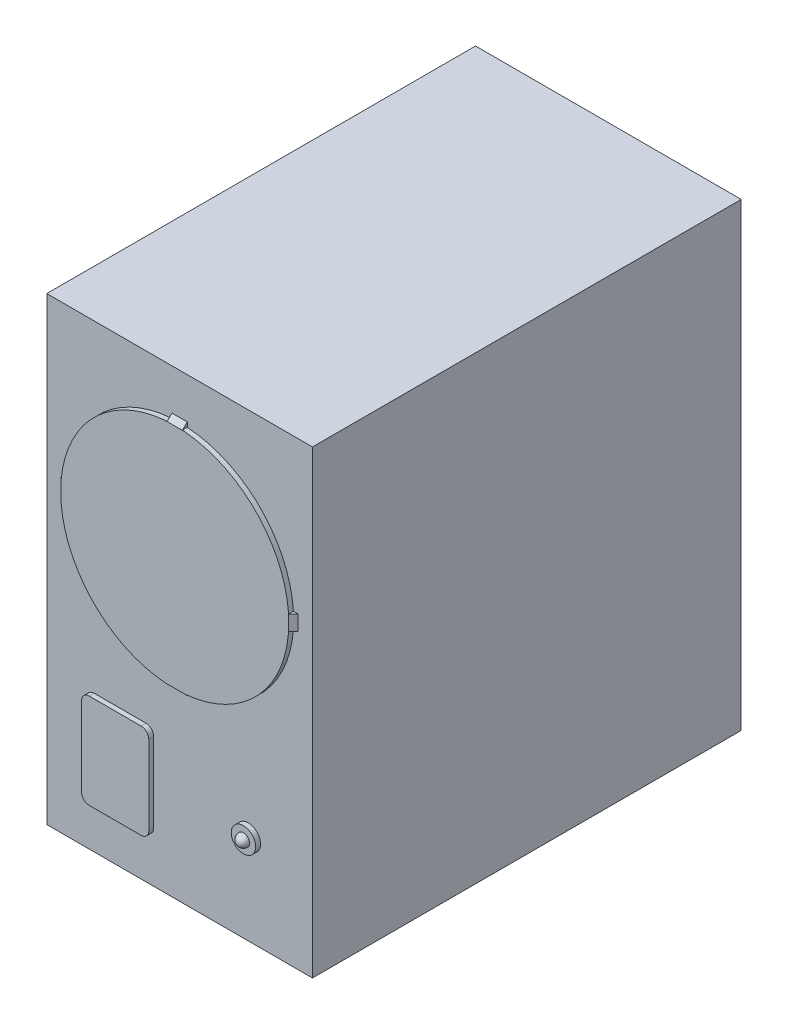
from build123d import *
from build123d.topology import SkipClean

# Parameters (mm, degrees)
ESQUISSE1_W        = 87
ESQUISSE1_H        = 140.4
BOSS_EXTRU_1_DEPTH = 150.6
ESQUISSE2_W        = 2.433761929
ESQUISSE2_H        = 5
ESQUISSE2_W_2      = 5
ESQUISSE2_H_2      = 2.433761929
ESQUISSE2_R        = 4
BOSS_EXTRU_5_DEPTH = 1.6
R_VOLUTION1_ANGLE  = 180
CHANFREIN1_SIZE    = 2.5
BOSS_EXTRU_6_DEPTH = 5


with BuildPart() as part:
    # Esquisse1 → Boss.-Extru.1 (new body)
    with BuildSketch(Plane(origin=(0, 0, 0), x_dir=(1, 0, 0), z_dir=(0, 1, 0))):
        Rectangle(ESQUISSE1_W, ESQUISSE1_H)
    extrude(amount=BOSS_EXTRU_1_DEPTH)

    # Esquisse2 → Boss.-Extru.5 (add)
    with BuildSketch(Plane.XY.offset(70.2)):
        with BuildLine():
            Line((-37.266238071, 100.9), (-37.266238071, 95.9))
            ThreePointArc((-37.266238071, 95.9), (-26.410438277, 71.989561723), (-2.5, 61.133761929))
            Line((-2.5, 61.133761929), (2.5, 61.133761929))
            ThreePointArc((2.5, 61.133761929), (26.410438277, 71.989561723), (37.266238071, 95.9))
            Line((37.266238071, 95.9), (37.266238071, 100.9))
            ThreePointArc((37.266238071, 100.9), (26.410438277, 124.810438277), (2.5, 135.666238071))
            Line((2.5, 135.666238071), (-2.5, 135.666238071))
            ThreePointArc((-2.5, 135.666238071), (-26.410438277, 124.810438277), (-37.266238071, 100.9))
        make_face()
        with Locations((38.483119036, 98.4)):
            Rectangle(ESQUISSE2_W, ESQUISSE2_H)
        with Locations((0, 136.883119036)):
            Rectangle(ESQUISSE2_W_2, ESQUISSE2_H_2)
        with Locations((-38.483119036, 98.4)):
            Rectangle(ESQUISSE2_W, ESQUISSE2_H)
        with Locations((0, 59.916880965)):
            Rectangle(ESQUISSE2_W_2, ESQUISSE2_H_2)
        with BuildLine():
            Line((-11, 45), (-28, 45))
            ThreePointArc((-28, 45), (-29.767766953, 44.267766953), (-30.5, 42.5))
            Line((-30.5, 42.5), (-30.5, 16.5))
            ThreePointArc((-30.5, 16.5), (-29.767766953, 14.732233047), (-28, 14))
            Line((-28, 14), (-11, 14))
            ThreePointArc((-11, 14), (-9.232233047, 14.732233047), (-8.5, 16.5))
            Line((-8.5, 16.5), (-8.5, 42.5))
            ThreePointArc((-8.5, 42.5), (-9.232233047, 44.267766953), (-11, 45))
        make_face()
        with Locations(Location((22.5, 29.5, 0), (0, 0, 180))):
            Circle(ESQUISSE2_R)
    extrude(amount=BOSS_EXTRU_5_DEPTH)

    # Esquisse3 → Révolution1 (revolve)
    with SkipClean():  # the faces are left unmerged after this step: merging them gives an invalid solid
        with BuildSketch(Plane.XY.offset(71.8)):
            with BuildLine():
                ThreePointArc((24.5, 29.5), (22.5, 31.5), (20.5, 29.5))
                Line((20.5, 29.5), (24.5, 29.5))
            make_face()
            with BuildLine():
                Line((24.5, 29.5), (20.5, 29.5))
                ThreePointArc((20.5, 29.5), (22.5, 27.5), (24.5, 29.5))
            make_face()
        revolve(axis=Axis((20.5, 29.5, 71.8), (1, 0, 0)), revolution_arc=R_VOLUTION1_ANGLE)

    # Chanfrein1
    # the kernel refuses this chamfer: 2.5 mm, written as the material it adds along each edge
    # the kernel refuses this chamfer: 2.5 mm, written as the material it takes off along each edge
    with BuildSketch(Plane(origin=(8.92920747, 58.7, 71.8), x_dir=(0, -0.027495876610587663, -0.9996219169112968), z_dir=(-1, 0, 0))) as chanfrein1_2_piece_1_section:
        Polygon((CHANFREIN1_SIZE * 0.999621916911, -CHANFREIN1_SIZE * 0.0274958766106), (-CHANFREIN1_SIZE * 0.0274958766106, -CHANFREIN1_SIZE * 0.999621916911), (0, 0), align=None)
    chanfrein1_2_piece_1 = extrude(amount=17.85841494, mode=Mode.PRIVATE)
    chanfrein1_2_piece_1 = split(chanfrein1_2_piece_1, bisect_by=Plane(origin=(2.719982047, 61.166365842, 70.2), z_dir=(0, 0, 1)), keep=Keep.TOP, mode=Mode.PRIVATE)
    add(chanfrein1_2_piece_1, mode=Mode.SUBTRACT)
    with BuildSketch(Plane(origin=(-39.7, 89.47079253, 71.8), x_dir=(-0.027495876610587663, 0, -0.9996219169112968), z_dir=(0, 1, 0))) as chanfrein1_2_piece_2_section:
        Polygon((CHANFREIN1_SIZE * 0.999621916911, -CHANFREIN1_SIZE * 0.0274958766106), (-CHANFREIN1_SIZE * 0.0274958766106, -CHANFREIN1_SIZE * 0.999621916911), (0, 0), align=None)
    chanfrein1_2_piece_2 = extrude(amount=17.85841494, mode=Mode.PRIVATE)
    chanfrein1_2_piece_2 = split(chanfrein1_2_piece_2, bisect_by=Plane(origin=(-37.233634158, 95.680017953, 70.2), z_dir=(0, 0, 1)), keep=Keep.TOP, mode=Mode.PRIVATE)
    add(chanfrein1_2_piece_2, mode=Mode.SUBTRACT)
    with BuildSketch(Plane(origin=(-8.92920747, 138.1, 71.8), x_dir=(0, 0.02749587661058214, -0.9996219169112969), z_dir=(1, 0, 0))) as chanfrein1_2_piece_3_section:
        Polygon((CHANFREIN1_SIZE * 0.999621916911, -CHANFREIN1_SIZE * 0.0274958766106), (-CHANFREIN1_SIZE * 0.0274958766106, -CHANFREIN1_SIZE * 0.999621916911), (0, 0), align=None)
    chanfrein1_2_piece_3 = extrude(amount=17.85841494, mode=Mode.PRIVATE)
    chanfrein1_2_piece_3 = split(chanfrein1_2_piece_3, bisect_by=Plane(origin=(-2.719982047, 135.633634158, 70.2), z_dir=(0, 0, 1)), keep=Keep.TOP, mode=Mode.PRIVATE)
    add(chanfrein1_2_piece_3, mode=Mode.SUBTRACT)
    with BuildSketch(Plane(origin=(39.7, 107.32920747, 71.8), x_dir=(0.027495876610587663, 0, -0.9996219169112968), z_dir=(0, -1, 0))) as chanfrein1_2_piece_4_section:
        Polygon((CHANFREIN1_SIZE * 0.999621916911, -CHANFREIN1_SIZE * 0.0274958766106), (-CHANFREIN1_SIZE * 0.0274958766106, -CHANFREIN1_SIZE * 0.999621916911), (0, 0), align=None)
    chanfrein1_2_piece_4 = extrude(amount=17.85841494, mode=Mode.PRIVATE)
    chanfrein1_2_piece_4 = split(chanfrein1_2_piece_4, bisect_by=Plane(origin=(37.233634158, 101.119982047, 70.2), z_dir=(0, 0, 1)), keep=Keep.TOP, mode=Mode.PRIVATE)
    add(chanfrein1_2_piece_4, mode=Mode.SUBTRACT)

    # Esquisse4 → Boss.-Extru.6 (add)
    with BuildSketch(Plane(origin=(0, 0, -70.2), x_dir=(-1, 0, 0), z_dir=(0, 0, -1))):
        with BuildLine():
            Line((-8, 15), (-8, 0))
            Line((-8, 0), (8, 0))
            Line((8, 0), (8, 15))
            ThreePointArc((8, 15), (5.656854249, 20.656854249), (0, 23))
            ThreePointArc((0, 23), (-5.656854249, 20.656854249), (-8, 15))
        make_face()
    extrude(amount=BOSS_EXTRU_6_DEPTH)


solid = part.part
